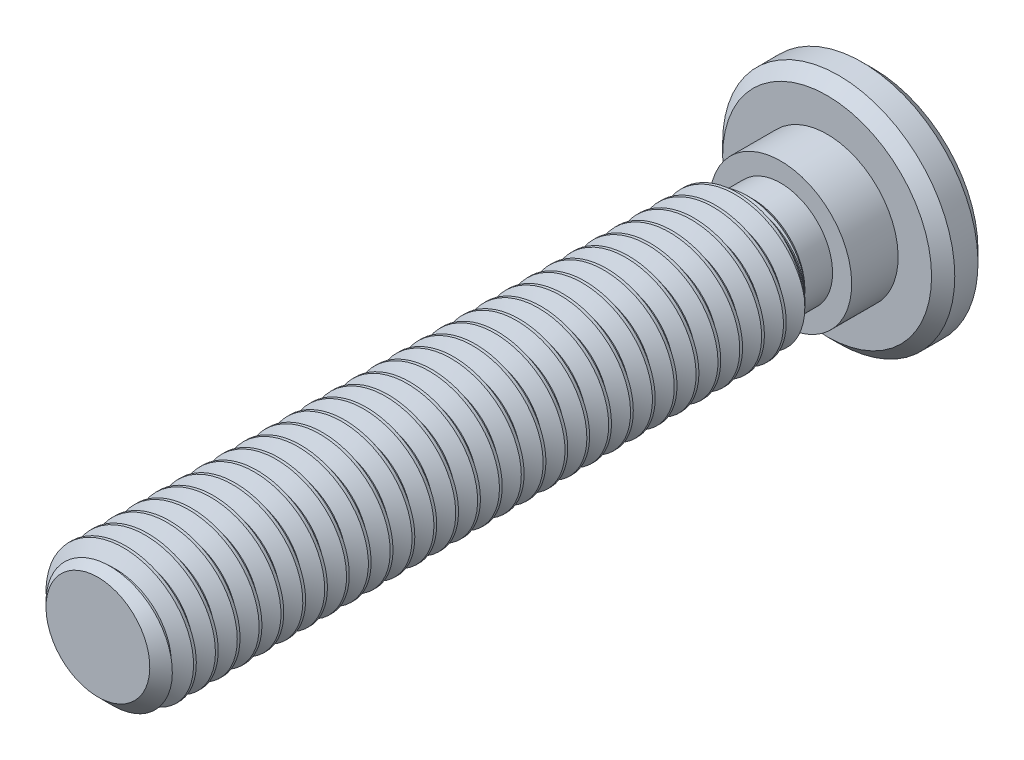
from build123d import *

# Parameters (mm, degrees)
CHAMFER2_SIZE      = 0.6
CUT_EXTRUDE1_DEPTH = 2.25
CHAMFER1_SIZE      = 0.425
CUT_SWEEP1_PITCH   = 0.8


with BuildPart() as part:
    # Sketch13 → Revolve1 (revolve)
    with BuildSketch(Plane(origin=(0, 0, 0), x_dir=(0, 0, -1), z_dir=(1, 0, 0)), mode=Mode.PRIVATE) as revolve1_sk:
        Polygon((1.7, 4.25), (0, 4.25), (0, 2.6), (-1.7, 2.6), (-1.7, 1.9), (-2.716, 1.9), (-3.316, 2.5), (-26.7, 2.5), (-26.7, 0), (1.7, 0), align=None)
    revolve(revolve1_sk.sketch.rotate(Axis((0, 0, 26.7), (0, 0, -1)), 180), axis=Axis((0, 0, 26.7), (0, 0, -1)))

    # Chamfer2
    chamfer2_edges = [part.edges().sort_by_distance(p)[0] for p in [
        (0, 2.5, 26.7),
    ]]
    chamfer(chamfer2_edges, length=CHAMFER2_SIZE)

    # Sketch7 → Cut-Extrude1 (cut)
    with BuildSketch(Plane(origin=(0, 0, -1.7), x_dir=(-1, 0, 0), z_dir=(0, 0, -1))):
        Polygon((0, 1.732050808), (-1.5, 0.866025404), (-1.5, -0.866025404), (0, -1.732050808), (1.5, -0.866025404), (1.5, 0.866025404), align=None)
    extrude(amount=-CUT_EXTRUDE1_DEPTH, mode=Mode.SUBTRACT)

    # Chamfer1
    chamfer1_edges = [part.edges().sort_by_distance(p)[0] for p in [
        (0, 4.25, 0),
        (0, 4.25, -1.7),
    ]]
    chamfer(chamfer1_edges, length=CHAMFER1_SIZE)

    # Cut-Extrude2 cone 1 section (through the dimple's axis) → Cut-Extrude2 (revolve, cut)
    with BuildSketch(Plane(origin=(0, 0, -1.7), x_dir=(0, 1, 0), z_dir=(1, 0, 0))):
        Polygon((0, 0), (1.732050808, 0), (0, 1.732050808), align=None)
    revolve(axis=Axis((0, 0, -1.7), (0, 0, 1)), mode=Mode.SUBTRACT)

    # Cut-Sweep1: the profile of Sketch3 screwed along a right-hand helix of 31.125 turns, 6 arcs to a turn; built about Z, then put on its axis
    cut_sweep1_z = Axis((0, 0, 0), (0, 0, 1))
    cut_sweep1_corners = [(2.54330127, 0, -0.725), (2.54330127, 0, 0.025), (1.980384758, 0, -0.3), (1.980384758, 0, -0.4)]
    with BuildLine(mode=Mode.PRIVATE) as cut_sweep1_profile:
        Line(cut_sweep1_corners[0], cut_sweep1_corners[1])
        Line(cut_sweep1_corners[1], cut_sweep1_corners[2])
        Line(cut_sweep1_corners[2], cut_sweep1_corners[3])
        Line(cut_sweep1_corners[3], cut_sweep1_corners[0])
    cut_sweep1_cap = Face(cut_sweep1_profile.wire())
    cut_sweep1_turn_angles = [0, 30, 60, 90, 120, 150, 180, 210, 240, 270, 300, 330, 360]
    cut_sweep1_turn_weights = [1, 0.8660254037844387, 1, 0.8660254037844387, 1, 0.8660254037844387, 1, 0.8660254037844387, 1, 0.8660254037844387, 1, 0.8660254037844387, 1]
    cut_sweep1_turn_rails = [Edge.make_bspline([Vector(p[0], p[1], 0).rotate(cut_sweep1_z, cut_sweep1_turn_angles[k]) / cut_sweep1_turn_weights[k] + Vector(0, 0, p[2] + CUT_SWEEP1_PITCH * cut_sweep1_turn_angles[k] / 360) for k in range(13)], [0, 0, 0, 1, 1, 2, 2, 3, 3, 4, 4, 5, 5, 6, 6, 6], 2, cut_sweep1_turn_weights) for p in cut_sweep1_corners]
    cut_sweep1_turn_sides = [Face.make_surface_from_curves(cut_sweep1_turn_rails[p[0]], cut_sweep1_turn_rails[p[1]]) for p in [(0, 1), (1, 2), (2, 3), (3, 0)]]
    cut_sweep1_last_angles = [11160, 11182.5, 11205]
    cut_sweep1_last_weights = [1, 0.9238795325115359, 1]
    cut_sweep1_last_rails = [Edge.make_bspline([Vector(p[0], p[1], 0).rotate(cut_sweep1_z, cut_sweep1_last_angles[k]) / cut_sweep1_last_weights[k] + Vector(0, 0, p[2] + CUT_SWEEP1_PITCH * cut_sweep1_last_angles[k] / 360) for k in range(3)], [0, 0, 0, 1, 1, 1], 2, cut_sweep1_last_weights) for p in cut_sweep1_corners]
    cut_sweep1_last_sides = [Face.make_surface_from_curves(cut_sweep1_last_rails[p[0]], cut_sweep1_last_rails[p[1]]) for p in [(0, 1), (1, 2), (2, 3), (3, 0)]]
    cut_sweep1 = Plane(origin=(0, 0, 26.7), x_dir=(0, 1, 0), z_dir=(0, 0, -1)) * Solid(Shell([*[p.moved(Location((0, 0, CUT_SWEEP1_PITCH * i))) for i in range(31) for p in cut_sweep1_turn_sides], *cut_sweep1_last_sides, cut_sweep1_cap, cut_sweep1_cap.rotate(cut_sweep1_z, 11205).moved(Location((0, 0, CUT_SWEEP1_PITCH * 11205 / 360)))]))
    add(cut_sweep1, mode=Mode.SUBTRACT)


solid = part.part
